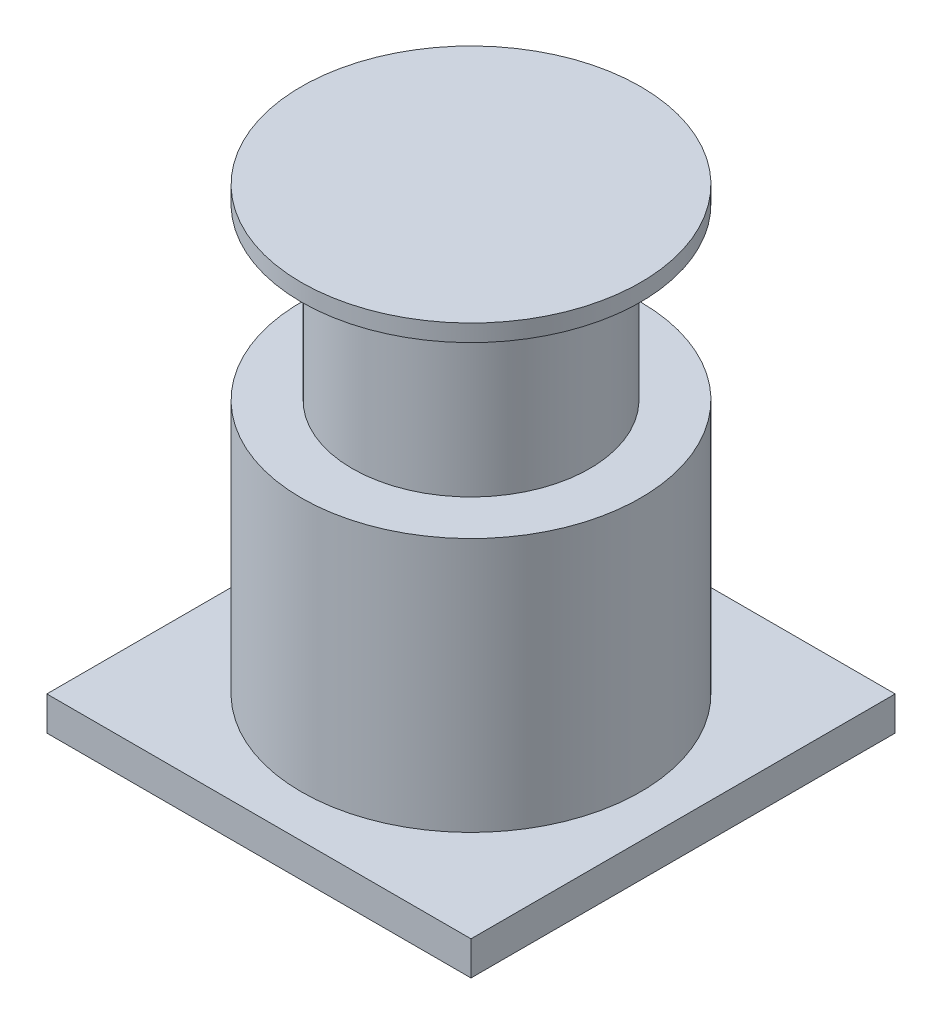
from build123d import *

# Parameters (mm, degrees)
SKETCH1_W           = 250
SKETCH1_H           = 250
BOSS_EXTRUDE1_DEPTH = 20
SKETCH2_R           = 100
BOSS_EXTRUDE2_DEPTH = 150
SKETCH3_R           = 70
BOSS_EXTRUDE3_DEPTH = 100
SKETCH4_R           = 100
BOSS_EXTRUDE4_DEPTH = 10


with BuildPart() as part:
    # Sketch1 → Boss-Extrude1 (new body)
    with BuildSketch(Plane(origin=(0, 0, 0), x_dir=(1, 0, 0), z_dir=(0, 1, 0))):
        with Locations((46.810699588, -38.16872428)):
            Rectangle(SKETCH1_W, SKETCH1_H)
    extrude(amount=BOSS_EXTRUDE1_DEPTH)

    # Sketch2 → Boss-Extrude2 (add)
    with BuildSketch(Plane(origin=(0, 20, 0), x_dir=(1, 0, 0), z_dir=(0, 1, 0))):
        with Locations((46.810699588, -38.16872428)):
            Circle(SKETCH2_R)
    extrude(amount=BOSS_EXTRUDE2_DEPTH)

    # Sketch3 → Boss-Extrude3 (add)
    with BuildSketch(Plane(origin=(0, 170, 0), x_dir=(1, 0, 0), z_dir=(0, 1, 0))):
        with Locations((46.810699588, -38.16872428)):
            Circle(SKETCH3_R)
    extrude(amount=BOSS_EXTRUDE3_DEPTH)

    # Sketch4 → Boss-Extrude4 (add)
    with BuildSketch(Plane(origin=(0, 270, 0), x_dir=(1, 0, 0), z_dir=(0, 1, 0))):
        with Locations((46.810699588, -38.16872428)):
            Circle(SKETCH4_R)
    extrude(amount=BOSS_EXTRUDE4_DEPTH)


solid = part.part
